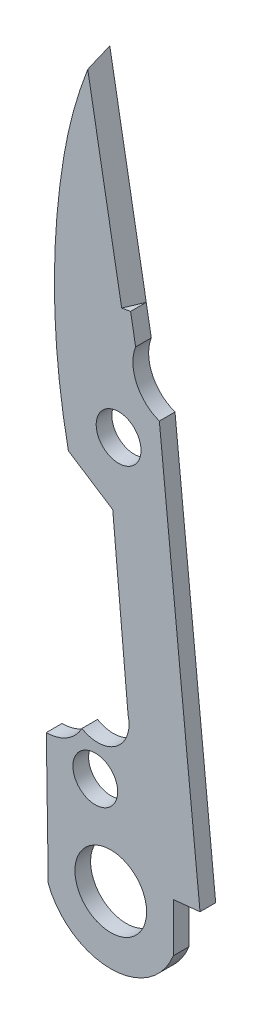
from build123d import *

# Parameters (mm, degrees)
SKETCH1_R           = 1.27
BOSS_EXTRUDE3_DEPTH = 0.889
SKETCH3_R           = 2.032
CUT_EXTRUDE1_DEPTH  = 85.599842492
CUT_EXTRUDE2_DEPTH  = 22.86


with BuildPart() as part:
    # Sketch1 → Boss-Extrude3 (new body)
    with BuildSketch(Plane.XY):
        with BuildLine():
            Line((54.212250122, 59.419441565), (56.56360068, 46.264500713))
            ThreePointArc((56.56360068, 46.264500713), (56.615044517, 44.500180003), (57.90781187, 43.298420207))
            Line((57.90781187, 43.298420207), (60.213561534, 20.356500713))
            Line((60.213561534, 20.356500713), (58.69720068, 20.204100713))
            Line((58.69720068, 20.204100713), (58.69720068, 17.435500713))
            ThreePointArc((58.69720068, 17.435500713), (55.15390068, 15.02590248), (51.61060068, 17.435500713))
            Line((51.61060068, 17.435500713), (51.500193415, 24.801500713))
            ThreePointArc((51.500193415, 24.801500713), (52.674827813, 25.126370929), (53.51560068, 26.008645044))
            ThreePointArc((53.51560068, 26.008645044), (55.478305908, 26.122647996), (56.136100356, 27.975352761))
            Line((56.136100356, 27.975352761), (55.265438284, 37.628500713))
            Line((55.265438284, 37.628500713), (52.75204602, 39.254100713))
            ThreePointArc((52.75204602, 39.254100713), (51.963944562, 46.430678316), (52.49960068, 53.630500713))
            ThreePointArc((52.49960068, 53.630500713), (53.179779004, 56.577083785), (54.212250122, 59.419441565))
        make_face()
        with Locations((55.59840068, 41.336900713)):
            Circle(SKETCH1_R, mode=Mode.SUBTRACT)
        with Locations((54.27760068, 23.912500713)):
            Circle(SKETCH1_R, mode=Mode.SUBTRACT)
    extrude(amount=BOSS_EXTRUDE3_DEPTH)

    # Sketch3 → Cut-Extrude1 (cut, through all)
    with BuildSketch(Plane.XY.offset(0.889)):
        with Locations((55.15390068, 18.83590248)):
            Circle(SKETCH3_R)
    extrude(amount=-CUT_EXTRUDE1_DEPTH, mode=Mode.SUBTRACT)

    # Sketch4 → Cut-Extrude2 (cut)
    with BuildSketch(Plane(origin=(-10.570927747, 59.140449626, 0), x_dir=(0.9843983734793632, 0.17595409143064608, 0), z_dir=(-0.17595409143064608, 0.9843983734793632, 0))):
        Polygon((63.821544696, 0), (63.821544696, -0.889), (63.308280307, -0.889), align=None)
    extrude(amount=-CUT_EXTRUDE2_DEPTH, mode=Mode.SUBTRACT)


solid = part.part
